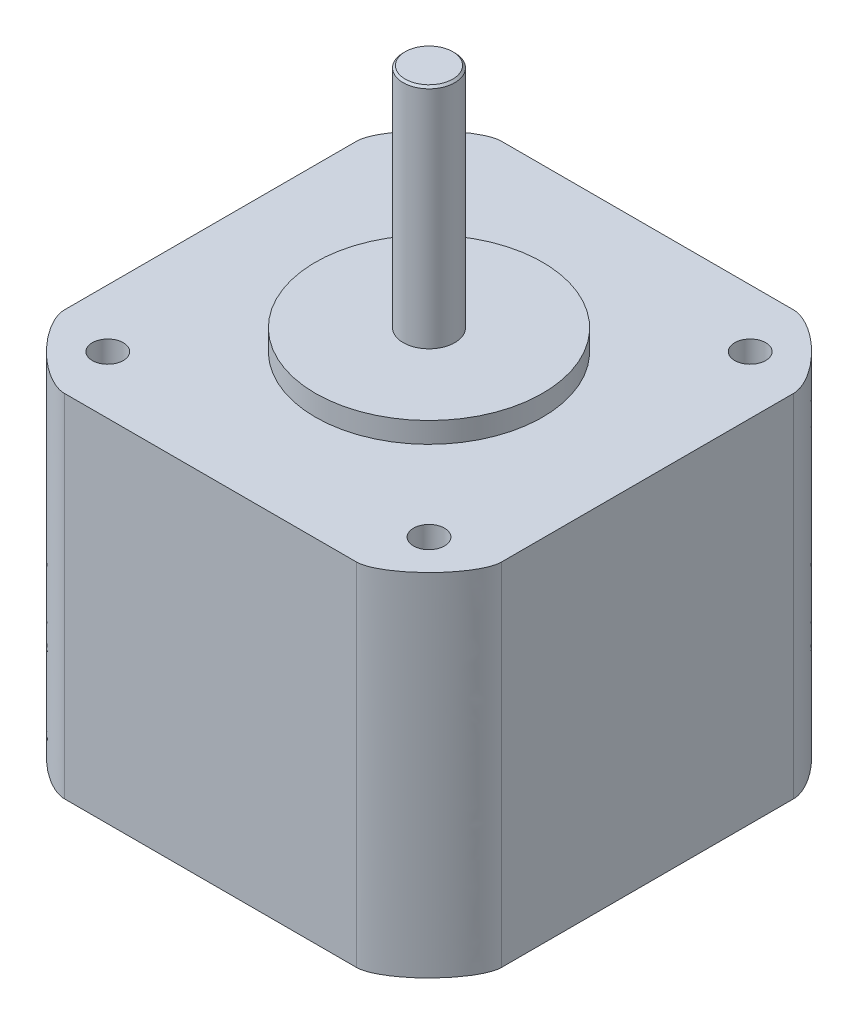
from build123d import *

# Parameters (mm, degrees)
SKETCH1_W           = 42.3
SKETCH1_H           = 42.3
BOSS_EXTRUDE1_DEPTH = 34
FILLET1_SIZE        = 7
SKETCH1_3_R         = 1.5
CUT_EXTRUDE1_DEPTH  = 4
SKETCH3_R           = 11
SKETCH3_R_2         = 2.5
BOSS_EXTRUDE2_DEPTH = 2
SKETCH3_2_R         = 2.5
BOSS_EXTRUDE3_DEPTH = 24
CHAMFER1_SIZE       = 0.2


with BuildPart() as part:
    # Sketch1 → Boss-Extrude1 (new body)
    with BuildSketch(Plane(origin=(0, 0, 0), x_dir=(1, 0, 0), z_dir=(0, 1, 0))):
        Rectangle(SKETCH1_W, SKETCH1_H)
    extrude(amount=-BOSS_EXTRUDE1_DEPTH)

    # Fillet1
    # a fillet whose section is not a circle: 7 mm, written as the material it takes off along each edge
    with BuildSketch(Plane(origin=(21.15, 17.5, 21.15), x_dir=(-1, 0, 0), z_dir=(0, -1, 0)), Plane(origin=(21.15, 17.5, -21.15), x_dir=(0, 0, 1), z_dir=(0, -1, 0)), Plane(origin=(-21.15, 17.5, -21.15), x_dir=(1, 0, 0), z_dir=(0, -1, 0))) as fillet1_piece_1:
        with BuildLine():
            Bezier((FILLET1_SIZE, 0), (0, 0), (0, FILLET1_SIZE), weights=[1, 0.333333333, 1])
            Line((0, FILLET1_SIZE), (0, 0))
            Line((0, 0), (FILLET1_SIZE, 0))
        make_face()
    extrude(amount=69, mode=Mode.SUBTRACT)
    with BuildSketch(Plane(origin=(-21.15, 17.5, 21.15), x_dir=(1, 0, 0), z_dir=(0, -1, 0))) as fillet1_piece_2:
        with BuildLine():
            Bezier((FILLET1_SIZE, 0), (0, 0), (0, -FILLET1_SIZE), weights=[1, 0.333333333, 1])
            Line((0, -FILLET1_SIZE), (0, 0))
            Line((0, 0), (FILLET1_SIZE, 0))
        make_face()
    extrude(amount=69, mode=Mode.SUBTRACT)

    # Sketch1<3> → Cut-Extrude1 (cut)
    with BuildSketch(Plane(origin=(0, 0, 0), x_dir=(1, 0, 0), z_dir=(0, 1, 0))):
        with Locations(Location((-15.55, -15.55, 0), (0, 0, 270))):
            Circle(SKETCH1_3_R)
        with Locations(Location((-15.55, 15.55, 0), (0, 0, 270))):
            Circle(SKETCH1_3_R)
        with Locations(Location((15.55, 15.55, 0), (0, 0, 270))):
            Circle(SKETCH1_3_R)
        with Locations(Location((15.55, -15.55, 0), (0, 0, 270))):
            Circle(SKETCH1_3_R)
    extrude(amount=-CUT_EXTRUDE1_DEPTH, mode=Mode.SUBTRACT)

    # Sketch3 → Boss-Extrude2 (add)
    with BuildSketch(Plane(origin=(0, 0, 0), x_dir=(1, 0, 0), z_dir=(0, 1, 0))):
        with Locations(Location((0, 0, 0), (0, 0, 270))):
            Circle(SKETCH3_R)
        with Locations(Location((0, 0, 0), (0, 0, 270))):
            Circle(SKETCH3_R_2, mode=Mode.SUBTRACT)
    extrude(amount=BOSS_EXTRUDE2_DEPTH)

    # Sketch3<2> → Boss-Extrude3 (add)
    with BuildSketch(Plane(origin=(0, 0, 0), x_dir=(1, 0, 0), z_dir=(0, 1, 0))):
        with Locations(Location((0, 0, 0), (0, 0, 270))):
            Circle(SKETCH3_2_R)
    extrude(amount=BOSS_EXTRUDE3_DEPTH)

    # Chamfer1
    chamfer1_edges = [part.edges().sort_by_distance(p)[0] for p in [
        (0, 24, -2.5),
    ]]
    chamfer(chamfer1_edges, length=CHAMFER1_SIZE)


solid = part.part
